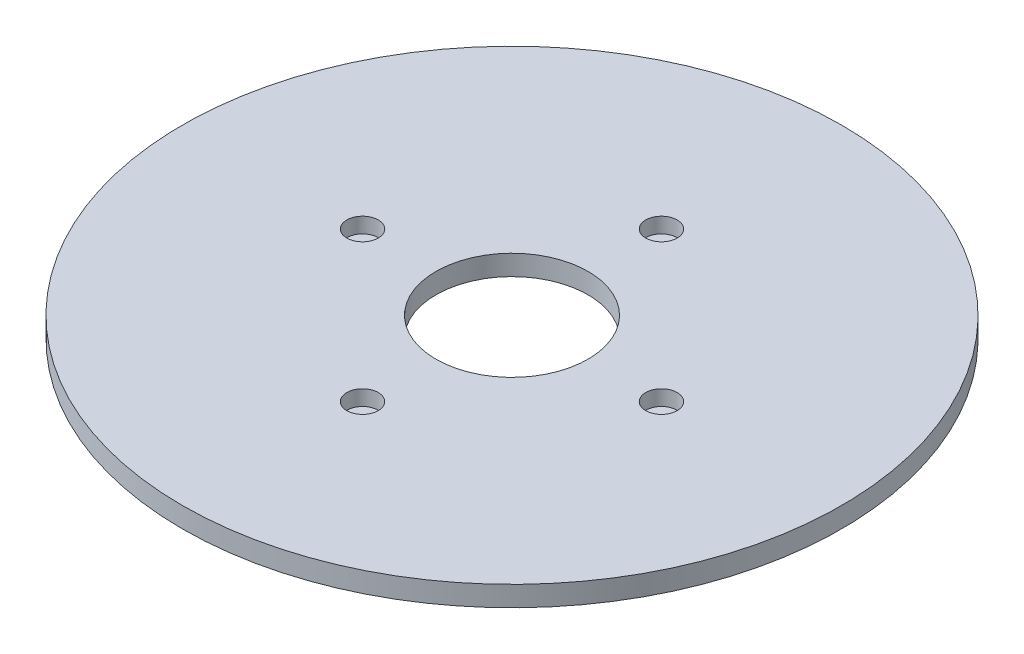
from build123d import *

# Parameters (mm, degrees)
SKETCH1_R           = 65
BOSS_EXTRUDE1_DEPTH = 4
SKETCH2_R           = 15
CUT_EXTRUDE1_DEPTH  = 93.010868923
SKETCH3_R           = 3.099579468
CUT_EXTRUDE2_DEPTH  = 3.030621265
CIRPATTERN1_COUNT   = 4


with BuildPart() as part:
    # Sketch1 → Boss-Extrude1 (new body)
    with BuildSketch(Plane(origin=(0, 0, 0), x_dir=(1, 0, 0), z_dir=(0, 1, 0))):
        Circle(SKETCH1_R)
    extrude(amount=BOSS_EXTRUDE1_DEPTH)

    # Sketch2 → Cut-Extrude1 (cut, through all)
    with BuildSketch(Plane(origin=(0, 0, 0), x_dir=(1, 0, 0), z_dir=(0, 1, 0))):
        Circle(SKETCH2_R)
    extrude(amount=CUT_EXTRUDE1_DEPTH, mode=Mode.SUBTRACT)

    # Sketch3 → Cut-Extrude2 (cut)
    with BuildSketch(Plane(origin=(0, 4, 0), x_dir=(1, 0, 0), z_dir=(0, 1, 0))):
        with Locations((-29.477256254, 0)):
            Circle(SKETCH3_R)
    cut_extrude2 = extrude(amount=-CUT_EXTRUDE2_DEPTH, mode=Mode.SUBTRACT)

    # CirPattern1: Cut-Extrude2 ×4 about axis
    cirpattern1_axis = Axis((0, 0, 0), (0, 1, 0))
    for i in range(1, CIRPATTERN1_COUNT):
        add(cut_extrude2.rotate(cirpattern1_axis, i * 360 / CIRPATTERN1_COUNT), mode=Mode.SUBTRACT)


solid = part.part
